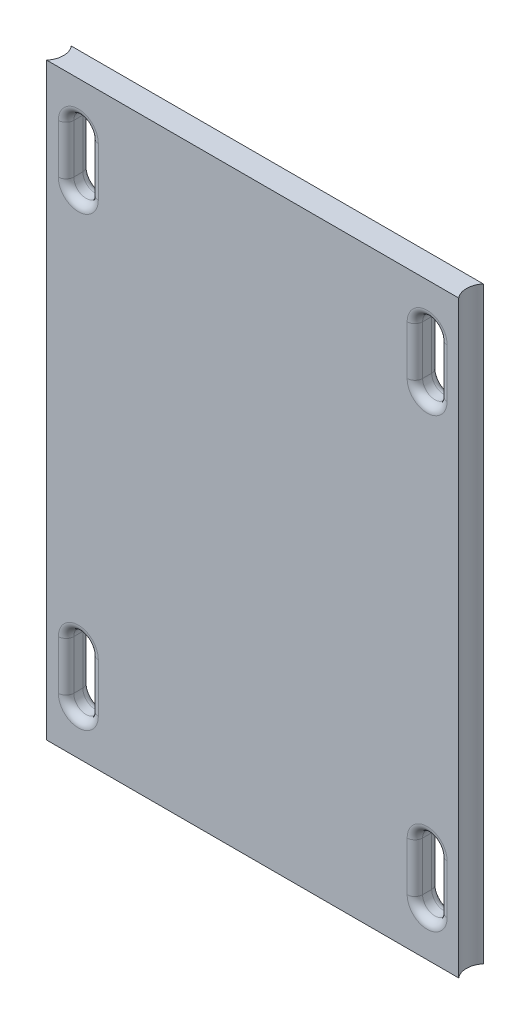
from build123d import *

# Parameters (mm, degrees)
BOSS_EXTRUDE1_DEPTH     = 76.2
CUT_EXTRUDE1_DEPTH      = 81.79080821
CUT_EXTRUDE1_DEPTH_BACK = 81.79080821
FILLET1_R               = 1


with BuildPart() as part:
    # Sketch1 → Boss-Extrude1 (new body)
    with BuildSketch(Plane(origin=(0, 0, 0), x_dir=(1, 0, 0), z_dir=(0, 1, 0))):
        with BuildLine():
            ThreePointArc((-26.0858, 0), (-26.233140847, -0.843689723), (-26.657720576, -1.5875))
            Line((-26.657720576, -1.5875), (26.657720576, -1.5875))
            ThreePointArc((26.657720576, -1.5875), (26.0858, 0), (26.657720576, 1.5875))
            Line((26.657720576, 1.5875), (-26.657720576, 1.5875))
            ThreePointArc((-26.657720576, 1.5875), (-26.233140847, 0.843689723), (-26.0858, 0))
        make_face()
    extrude(amount=BOSS_EXTRUDE1_DEPTH)

    # Sketch2 → Cut-Extrude1 (cut, two sides: drawn at the far end of the back side and taken through both)
    with BuildSketch(Plane.XY.offset(1.5875).offset(-CUT_EXTRUDE1_DEPTH_BACK)):
        with BuildLine():
            Line((-20.982720576, 70.2), (-20.982720576, 63.85))
            ThreePointArc((-20.982720576, 63.85), (-22.570220576, 62.2625), (-24.157720576, 63.85))
            Line((-24.157720576, 63.85), (-24.157720576, 70.2))
            ThreePointArc((-24.157720576, 70.2), (-22.570220576, 71.7875), (-20.982720576, 70.2))
        make_face()
        with BuildLine():
            Line((20.982720576, 70.2), (20.982720576, 63.85))
            ThreePointArc((20.982720576, 63.85), (22.570220576, 62.2625), (24.157720576, 63.85))
            Line((24.157720576, 63.85), (24.157720576, 70.2))
            ThreePointArc((24.157720576, 70.2), (22.570220576, 71.7875), (20.982720576, 70.2))
        make_face()
        with BuildLine():
            Line((20.982720576, 6), (20.982720576, 12.35))
            ThreePointArc((20.982720576, 12.35), (22.570220576, 13.9375), (24.157720576, 12.35))
            Line((24.157720576, 12.35), (24.157720576, 6))
            ThreePointArc((24.157720576, 6), (22.570220576, 4.4125), (20.982720576, 6))
        make_face()
        with BuildLine():
            Line((-20.982720576, 6), (-20.982720576, 12.35))
            ThreePointArc((-20.982720576, 12.35), (-22.570220576, 13.9375), (-24.157720576, 12.35))
            Line((-24.157720576, 12.35), (-24.157720576, 6))
            ThreePointArc((-24.157720576, 6), (-22.570220576, 4.4125), (-20.982720576, 6))
        make_face()
    extrude(amount=CUT_EXTRUDE1_DEPTH + CUT_EXTRUDE1_DEPTH_BACK, mode=Mode.SUBTRACT)

    # Fillet1
    fillet1_edges = [part.edges().sort_by_distance(p)[0] for p in [
        (24.157720576, 67.025, 1.5875),
        (22.570220576, 71.7875, 1.5875),
        (20.982720576, 67.025, 1.5875),
        (20.982720576, 67.025, -1.5875),
        (22.570220576, 71.7875, -1.5875),
        (24.157720576, 67.025, -1.5875),
        (24.157720576, 9.175, 1.5875),
        (22.570220576, 13.9375, 1.5875),
        (20.982720576, 9.175, 1.5875),
        (20.982720576, 9.175, -1.5875),
        (22.570220576, 13.9375, -1.5875),
        (24.157720576, 9.175, -1.5875),
        (-20.982720576, 9.175, 1.5875),
        (-22.570220576, 13.9375, 1.5875),
        (-24.157720576, 9.175, 1.5875),
        (-24.157720576, 9.175, -1.5875),
        (-22.570220576, 13.9375, -1.5875),
        (-20.982720576, 9.175, -1.5875),
        (-20.982720576, 67.025, 1.5875),
        (-22.570220576, 71.7875, 1.5875),
        (-24.157720576, 67.025, 1.5875),
        (-24.157720576, 67.025, -1.5875),
        (-22.570220576, 71.7875, -1.5875),
        (-20.982720576, 67.025, -1.5875),
        (22.570220576, 62.2625, 1.5875),
        (22.570220576, 62.2625, -1.5875),
        (22.570220576, 4.4125, 1.5875),
        (22.570220576, 4.4125, -1.5875),
        (-22.570220576, 4.4125, 1.5875),
        (-22.570220576, 4.4125, -1.5875),
        (-22.570220576, 62.2625, 1.5875),
        (-22.570220576, 62.2625, -1.5875),
    ]]
    fillet(fillet1_edges, radius=FILLET1_R)


solid = part.part
